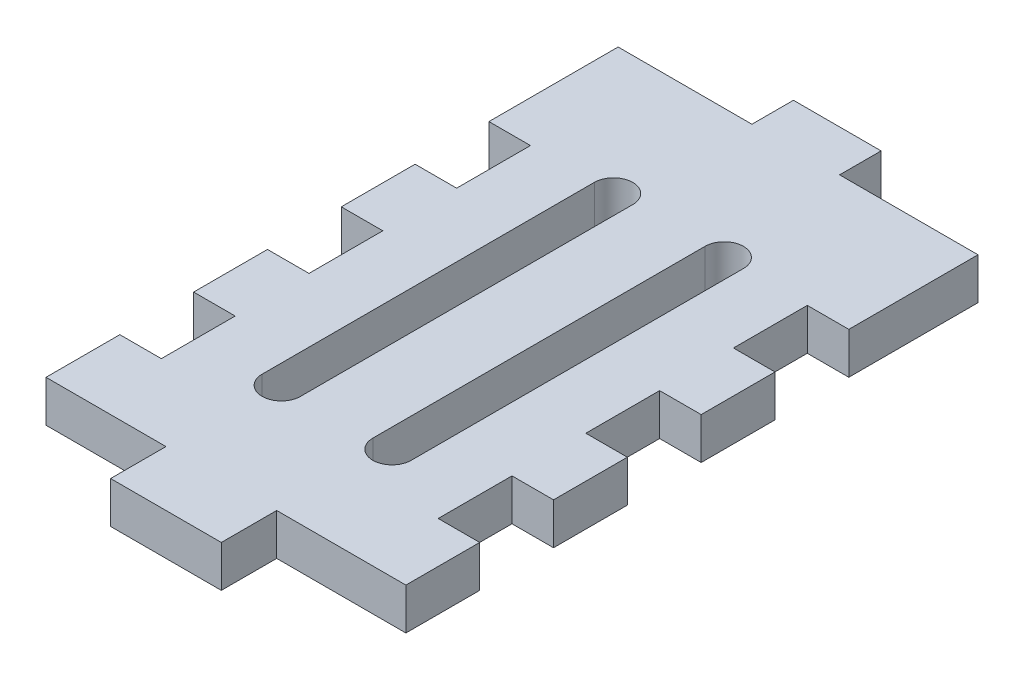
from build123d import *

# Parameters (mm, degrees)
BOSS_EXTRUDE1_DEPTH = 4.5


with BuildPart() as part:
    # Sketch1 → Boss-Extrude1 (new body)
    with BuildSketch(Plane(origin=(0, 0, 0), x_dir=(1, 0, 0), z_dir=(0, 1, 0))):
        Polygon((5, 36.5), (-4.5, 36.5), (-4.5, 32), (-14.5, 32), (-19, 32), (-19, 18), (-14.5, 18), (-14.5, 10), (-19, 10), (-19, 2), (-14.5, 2), (-14.5, -6), (-19, -6), (-19, -14), (-14.5, -14), (-14.5, -22), (-19, -22), (-19, -30), (-14.5, -30), (-6, -30), (-6, -36), (6, -36), (6, -30), (15.5, -30), (20, -30), (20, -22), (15.5, -22), (15.5, -14), (20, -14), (20, -6), (15.5, -6), (15.5, 2), (20, 2), (20, 10), (15.5, 10), (15.5, 18), (20, 18), (20, 32), (15.5, 32), (5, 32), align=None)
        with BuildLine():
            ThreePointArc((-3.416666667, -18), (-5.5, -20.083333333), (-7.583333333, -18))
            Line((-7.583333333, -18), (-7.583333333, 17.999999999))
            ThreePointArc((-7.583333333, 17.999999999), (-5.500000001, 20.083333334), (-3.416666667, 18))
            Line((-3.416666667, 18), (-3.416666667, -18))
        make_face(mode=Mode.SUBTRACT)
        with BuildLine():
            Line((8.583333333, 17.999999999), (8.583333333, -18))
            ThreePointArc((8.583333333, -18), (6.5, -20.083333333), (4.416666667, -18))
            Line((4.416666667, -18), (4.416666667, 18))
            ThreePointArc((4.416666667, 18), (6.500000001, 20.083333334), (8.583333333, 17.999999999))
        make_face(mode=Mode.SUBTRACT)
    extrude(amount=BOSS_EXTRUDE1_DEPTH)


solid = part.part
